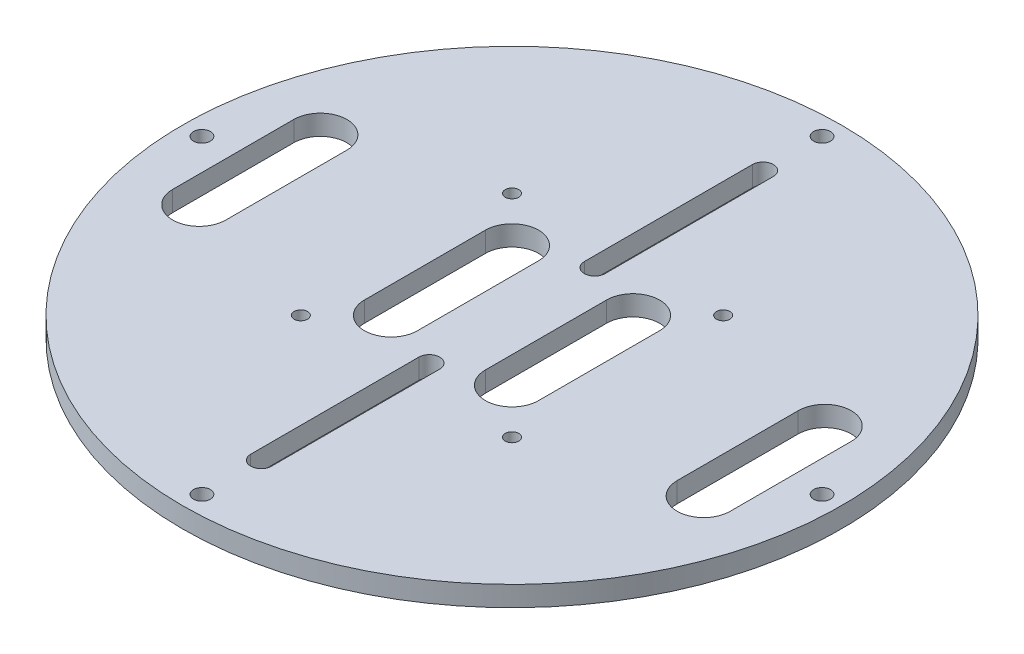
from build123d import *

# Parameters (mm, degrees)
SKETCH_1_R                      = 49
EXTRUDE_1_DEPTH                 = 3
CUT_EXTRUDE_1_DEPTH             = 70.361372535
PATTERN_CIRCULAR_2_COUNT        = 2
CUT_EXTRUDE_3_DEPTH             = 70.361372535
PATTERN_LINEAR_1_COUNT          = 2
PATTERN_LINEAR_1_PITCH          = 28.5
PATTERN_CIRCULAR_5_COUNT        = 2
PATTERN_CIRCULAR_5_COPY_1_DEPTH = 70.361372535
SKETCH_14_R                     = 1.25
CUT_EXTRUDE_4_DEPTH             = 70.361372535
PATTERN_CIRCULAR_6_COUNT        = 4
SKETCH_8_R                      = 1
CUT_EXTRUDE_5_DEPTH             = 70.361372535
PATTERN_CIRCULAR_7_COUNT        = 4


with BuildPart() as part:
    # 草图1 → 凸台-拉伸1 (new body)
    with BuildSketch(Plane(origin=(0, 0, 0), x_dir=(1, 0, 0), z_dir=(0, 1, 0))):
        Circle(SKETCH_1_R)
    extrude(amount=EXTRUDE_1_DEPTH)

    # 草图6 → 切除-拉伸1 (cut, through all)
    with BuildSketch(Plane(origin=(0, 3, 0), x_dir=(1, 0, 0), z_dir=(0, 1, 0))):
        with BuildLine():
            Line((-1.55, 12.3), (-1.55, 37.3))
            ThreePointArc((-1.55, 37.3), (0, 38.85), (1.55, 37.3))
            Line((1.55, 37.3), (1.55, 12.3))
            ThreePointArc((1.55, 12.3), (0, 10.75), (-1.55, 12.3))
        make_face()
    cut_extrude_1 = extrude(amount=-CUT_EXTRUDE_1_DEPTH, mode=Mode.SUBTRACT)

    # 阵列(圆周)2: 切除-拉伸1 ×2 about axis
    pattern_circular_2_axis = Axis((0, 3, 0), (0, -1, 0))
    for i in range(1, PATTERN_CIRCULAR_2_COUNT):
        add(cut_extrude_1.rotate(pattern_circular_2_axis, i * 360 / PATTERN_CIRCULAR_2_COUNT), mode=Mode.SUBTRACT)

    # 草图9 → 切除-拉伸3 (cut, through all)
    with BuildSketch(Plane(origin=(0, 3, 0), x_dir=(1, 0, 0), z_dir=(0, 1, 0))):
        with BuildLine():
            Line((-12.95, -9), (-12.95, 9))
            ThreePointArc((-12.95, 9), (-9, 12.95), (-5.05, 9))
            Line((-5.05, 9), (-5.05, -9))
            ThreePointArc((-5.05, -9), (-9, -12.95), (-12.95, -9))
        make_face()
    cut_extrude_3 = extrude(amount=-CUT_EXTRUDE_3_DEPTH, mode=Mode.SUBTRACT)

    # 阵列(线性)1: 切除-拉伸3 ×2
    with Locations(*[(-i * PATTERN_LINEAR_1_PITCH, 0, 0) for i in range(1, PATTERN_LINEAR_1_COUNT)]):
        add(cut_extrude_3, mode=Mode.SUBTRACT)

    # 阵列(圆周)5: 切除-拉伸3 ×2 about axis
    pattern_circular_5_axis = Axis((0, 3, 0), (0, -1, 0))
    for i in range(1, PATTERN_CIRCULAR_5_COUNT):
        add(cut_extrude_3.rotate(pattern_circular_5_axis, i * 360 / PATTERN_CIRCULAR_5_COUNT), mode=Mode.SUBTRACT)

    # 阵列(圆周)5 copy 1 sketch → 阵列(圆周)5 copy 1 (cut, through all)
    with BuildSketch(Plane(origin=(28.5, 3, 0), x_dir=(-1, 0, 0), z_dir=(0, 1, 0))):
        with BuildLine():
            Line((-12.95, -9), (-12.95, 9))
            ThreePointArc((-12.95, 9), (-9, 12.95), (-5.05, 9))
            Line((-5.05, 9), (-5.05, -9))
            ThreePointArc((-5.05, -9), (-9, -12.95), (-12.95, -9))
        make_face()
    extrude(amount=-PATTERN_CIRCULAR_5_COPY_1_DEPTH, mode=Mode.SUBTRACT)

    # 草图14 → 切除-拉伸4 (cut, through all)
    with BuildSketch(Plane(origin=(0, 3, 0), x_dir=(1, 0, 0), z_dir=(0, 1, 0))):
        with Locations((0, 46.1)):
            Circle(SKETCH_14_R)
    cut_extrude_4 = extrude(amount=-CUT_EXTRUDE_4_DEPTH, mode=Mode.SUBTRACT)

    # 阵列(圆周)6: 切除-拉伸4 ×4 about axis
    pattern_circular_6_axis = Axis((0, 3, 0), (0, -1, 0))
    for i in range(1, PATTERN_CIRCULAR_6_COUNT):
        add(cut_extrude_4.rotate(pattern_circular_6_axis, i * 360 / PATTERN_CIRCULAR_6_COUNT), mode=Mode.SUBTRACT)

    # 草图8 → 切除-拉伸5 (cut, through all)
    with BuildSketch(Plane(origin=(0, 3, 0), x_dir=(1, 0, 0), z_dir=(0, 1, 0))):
        with Locations((-15.7, 15.7)):
            Circle(SKETCH_8_R)
    cut_extrude_5 = extrude(amount=-CUT_EXTRUDE_5_DEPTH, mode=Mode.SUBTRACT)

    # 阵列(圆周)7: 切除-拉伸5 ×4 about axis
    pattern_circular_7_axis = Axis((0, 3, 0), (0, -1, 0))
    for i in range(1, PATTERN_CIRCULAR_7_COUNT):
        add(cut_extrude_5.rotate(pattern_circular_7_axis, i * 360 / PATTERN_CIRCULAR_7_COUNT), mode=Mode.SUBTRACT)


solid = part.part
